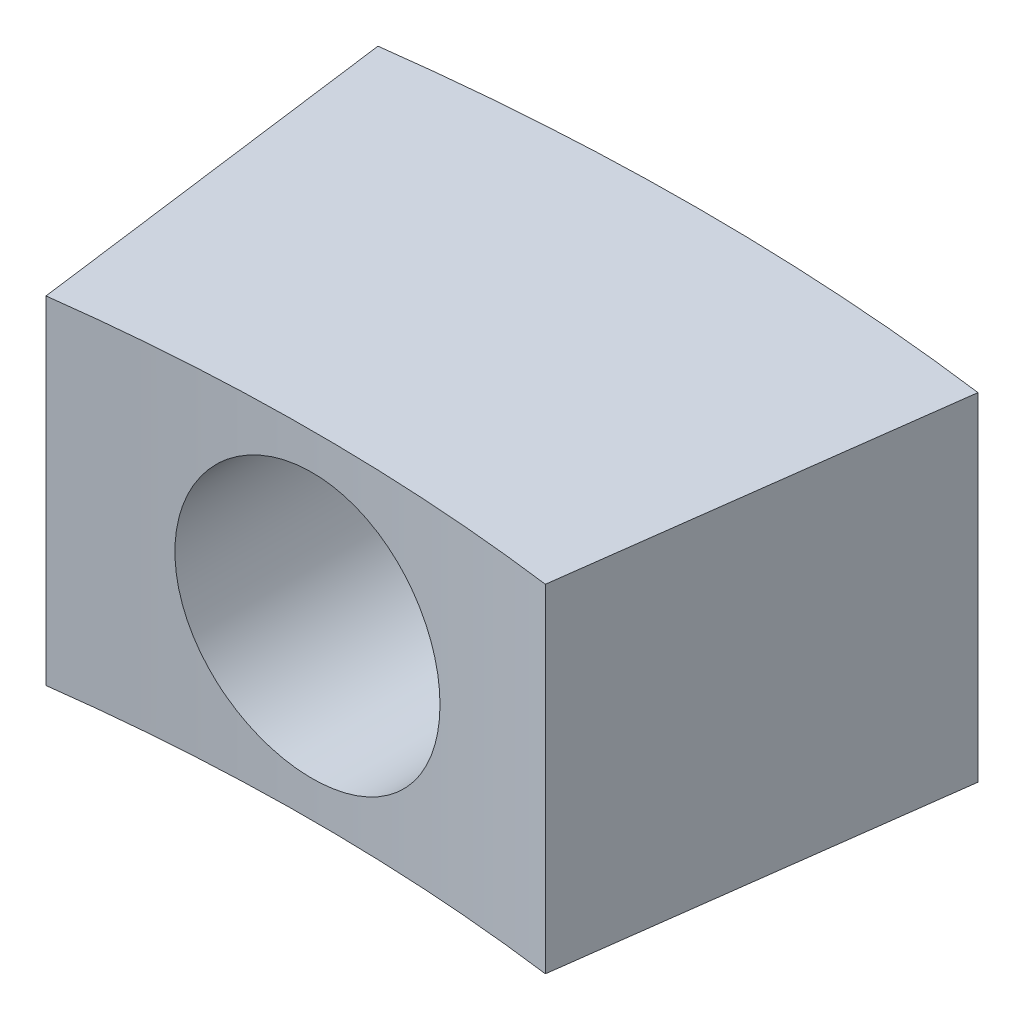
from build123d import *

# Parameters (mm, degrees)
BOSS_EXTRUDE1_DEPTH     = 3.499999985
CUT_EXTRUDE3_DEPTH      = 11.97923321
CUT_EXTRUDE3_DEPTH_BACK = 11.97923321
SKETCH3_R               = 2.749999961


with BuildPart() as part:
    # Sketch2 → Boss-Extrude1 (new, symmetric)
    with BuildSketch(Plane(origin=(0, 0, 0), x_dir=(1, 0, 0), z_dir=(0, 1, 0))):
        with BuildLine():
            Line((-6.224598318, -0.407981728), (-5.18038878, -8.339540621))
            ThreePointArc((-5.18038878, -8.339540621), (0, -8.000000002), (5.18038878, -8.339540621))
            Line((5.18038878, -8.339540621), (6.224598318, -0.407981728))
            ThreePointArc((6.224598318, -0.407981728), (0, 0), (-6.224598318, -0.407981728))
        make_face()
    extrude(amount=BOSS_EXTRUDE1_DEPTH, both=True)

    # Sketch3 → Cut-Extrude3 (cut, two sides: drawn at the far end of the back side and taken through both)
    with BuildSketch(Plane.XY.offset(-CUT_EXTRUDE3_DEPTH_BACK)):
        Circle(SKETCH3_R)
    extrude(amount=CUT_EXTRUDE3_DEPTH + CUT_EXTRUDE3_DEPTH_BACK, mode=Mode.SUBTRACT)


solid = part.part
